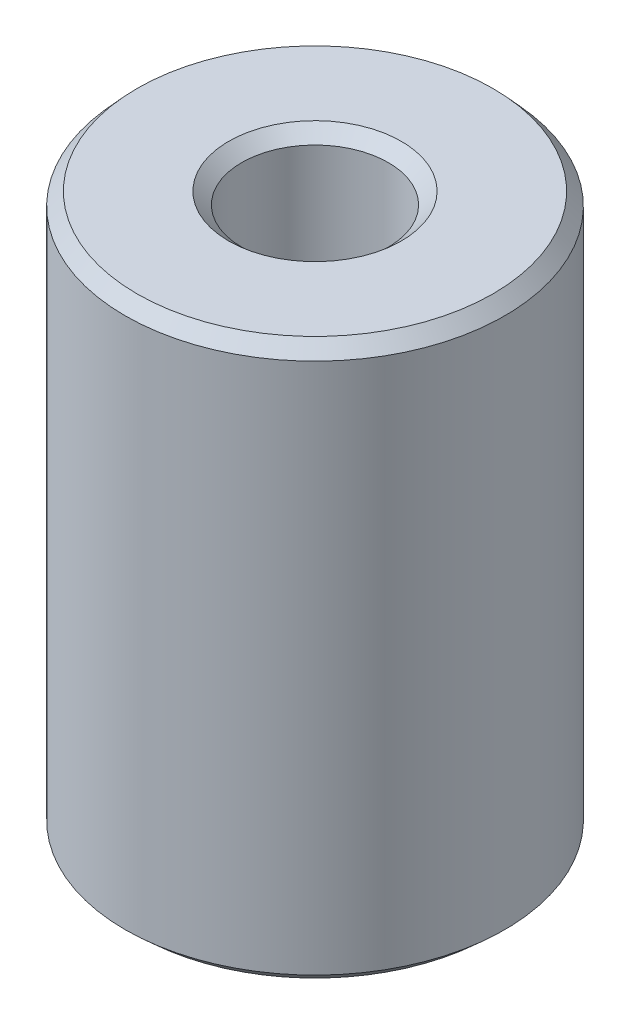
from build123d import *
from OCP.BRepFilletAPI import BRepFilletAPI_MakeChamfer

# Parameters (mm, degrees)
SKETCH1_R           = 17.5
BOSS_EXTRUDE1_DEPTH = 51.325409692
SKETCH2_R           = 6.758894523
CUT_EXTRUDE1_DEPTH  = 57.98067813
CHAMFER1_SIZE       = 1.205315232
CHAMFER1_SIZE2      = 1.09137758


with BuildPart() as part:
    # Sketch1 → Boss-Extrude1 (new body)
    with BuildSketch(Plane(origin=(0, 0, 0), x_dir=(1, 0, 0), z_dir=(0, 1, 0))):
        Circle(SKETCH1_R)
    extrude(amount=BOSS_EXTRUDE1_DEPTH)

    # Sketch2 → Cut-Extrude1 (cut, through all)
    with BuildSketch(Plane(origin=(0, 0, 0), x_dir=(1, 0, 0), z_dir=(0, 1, 0))):
        Circle(SKETCH2_R)
    extrude(amount=CUT_EXTRUDE1_DEPTH, mode=Mode.SUBTRACT)

    # Chamfer1: one chamfer whose edges measure the first distance from different faces: ONE call of the kernel's chamfer builder (chamfer() names one face for all edges)
    chamfer1_edges_1 = [part.edges().sort_by_distance(p)[0] for p in [
        (-6.758894523, 51.325409692, 0),
    ]]
    chamfer1_side_1 = [part.faces().sort_by_distance(p)[0] for p in [
        (-17.005025253, 51.325409692, 0),
    ]]
    chamfer1_edges_2 = [part.edges().sort_by_distance(p)[0] for p in [
        (-6.758894523, 0, 0),
    ]]
    chamfer1_side_2 = [part.faces().sort_by_distance(p)[0] for p in [
        (-6.758894523, 25.662704846, 0),
    ]]
    chamfer1_edges_3 = [part.edges().sort_by_distance(p)[0] for p in [
        (-17.5, 0, 0),
    ]]
    chamfer1_side_3 = [part.faces().sort_by_distance(p)[0] for p in [
        (-17.005025253, 0, 0),
    ]]
    chamfer1_edges_4 = [part.edges().sort_by_distance(p)[0] for p in [
        (-17.5, 51.325409692, 0),
    ]]
    chamfer1_side_4 = [part.faces().sort_by_distance(p)[0] for p in [
        (-17.5, 25.662704846, 0),
    ]]
    chamfer1 = BRepFilletAPI_MakeChamfer(part.part.solid().wrapped)
    for e in chamfer1_edges_1:
        chamfer1.Add(CHAMFER1_SIZE, CHAMFER1_SIZE2, e.wrapped, chamfer1_side_1[0].wrapped)  # the first distance lies on this face
    for e in chamfer1_edges_2:
        chamfer1.Add(CHAMFER1_SIZE, CHAMFER1_SIZE2, e.wrapped, chamfer1_side_2[0].wrapped)  # the first distance lies on this face
    for e in chamfer1_edges_3:
        chamfer1.Add(CHAMFER1_SIZE, CHAMFER1_SIZE2, e.wrapped, chamfer1_side_3[0].wrapped)  # the first distance lies on this face
    for e in chamfer1_edges_4:
        chamfer1.Add(CHAMFER1_SIZE, CHAMFER1_SIZE2, e.wrapped, chamfer1_side_4[0].wrapped)  # the first distance lies on this face
    add(Compound.cast(chamfer1.Shape()), mode=Mode.REPLACE)


solid = part.part
